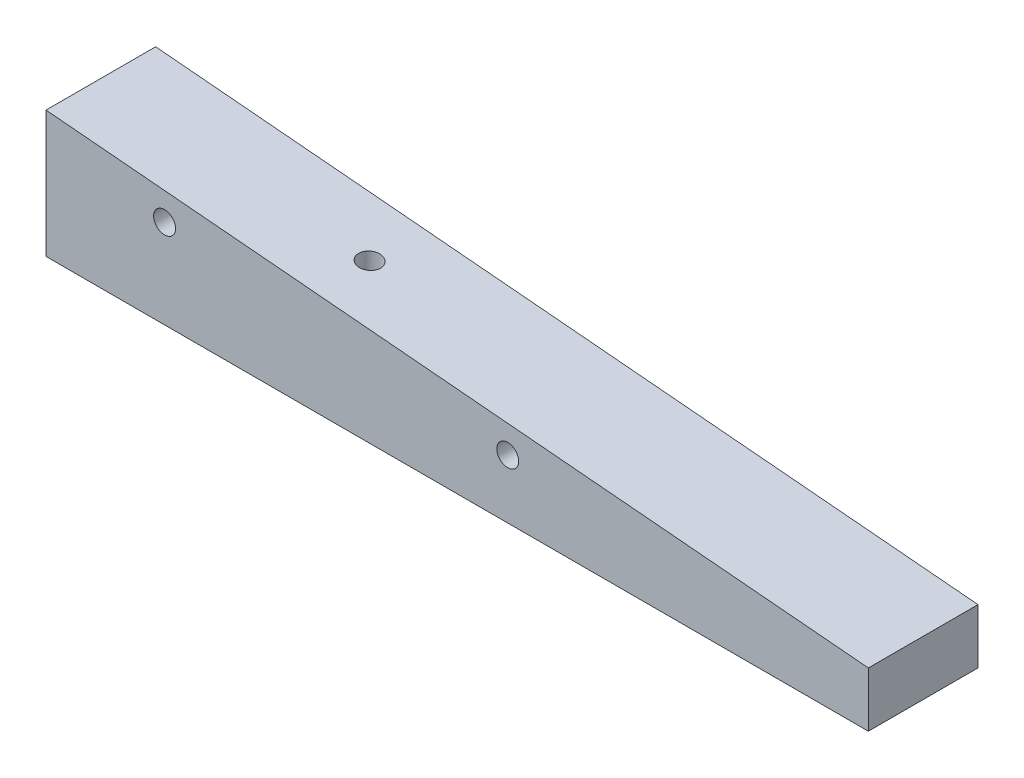
from build123d import *

# Parameters (mm, degrees)
BOSS_EXTRUDE1_DEPTH     = 10
SKETCH2_R               = 2
CUT_EXTRUDE1_DEPTH      = 105.067673886
CUT_EXTRUDE2_DEPTH      = 104.767117901
CUT_EXTRUDE2_DEPTH_BACK = 104.767117901
SKETCH3_R               = 2


with BuildPart() as part:
    # Sketch1 → Boss-Extrude1 (new, symmetric)
    with BuildSketch(Plane.XY):
        Polygon((100.972242556, 0), (-49.027757444, 13.123299529), (-49.027757444, -10), (100.972242556, -10), align=None)
    extrude(amount=BOSS_EXTRUDE1_DEPTH, both=True)

    # Sketch2 → Cut-Extrude1 (cut, through all)
    with BuildSketch(Plane.XZ.offset(10)):
        Circle(SKETCH2_R)
    extrude(amount=-CUT_EXTRUDE1_DEPTH, mode=Mode.SUBTRACT)

    # Sketch3 → Cut-Extrude2 (cut, two sides: drawn at the far end of the back side and taken through both)
    with BuildSketch(Plane.XY.offset(10).offset(-CUT_EXTRUDE2_DEPTH_BACK)):
        with Locations((-27.39963134, 6.211984494)):
            Circle(SKETCH3_R)
        with Locations((35.194081996, 0.735744169)):
            Circle(SKETCH3_R)
    extrude(amount=CUT_EXTRUDE2_DEPTH + CUT_EXTRUDE2_DEPTH_BACK, mode=Mode.SUBTRACT)


solid = part.part
